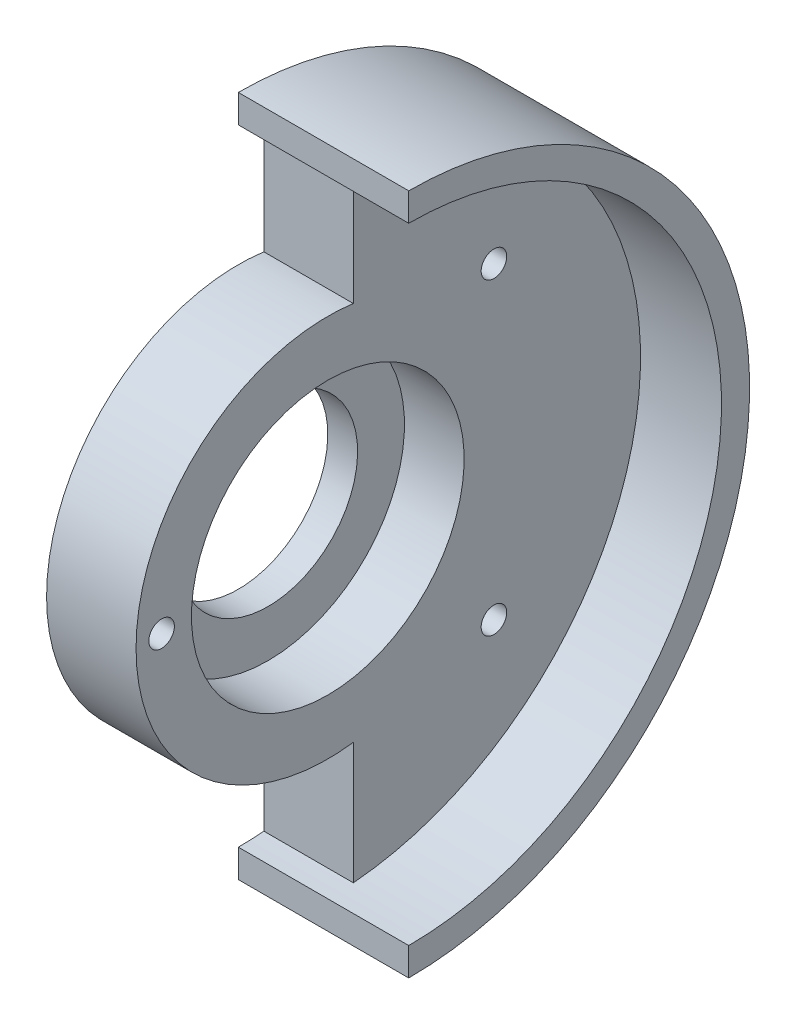
from build123d import *
from build123d.topology import SkipClean

# Parameters (mm, degrees)
CUT_EXTRUDE1_DEPTH      = 58.534772095
CUT_EXTRUDE1_DEPTH_BACK = 58.534772095
SKETCH2_R               = 1.5
SKETCH3_R               = 2.75
CUT_EXTRUDE2_DEPTH      = 5


with BuildPart() as part:
    # Sketch1 → Revolve1 (revolve)
    with BuildSketch(Plane.XY):
        Polygon((20, 40), (20, 36.7), (10.5, 36.7), (10.5, 16), (3.5, 16), (3.5, 10.5), (0, 10.5), (0, 40), align=None)
    revolve(axis=Axis((20, 0, 0), (-1, 0, 0)))

    # Sketch2 → Cut-Extrude1 (cut, two sides: drawn at the far end of the back side and taken through both)
    with SkipClean():  # the faces are left unmerged after this step: merging them gives an invalid solid
        with BuildSketch(Plane(origin=(10.5, 0, 0), x_dir=(0, 0, -1), z_dir=(1, 0, 0)).offset(-CUT_EXTRUDE1_DEPTH_BACK)):
            with Locations((-19.5, 0)):
                Circle(SKETCH2_R)
            with Locations((19.5, -18.091710809)):
                Circle(SKETCH2_R)
            with Locations((19.5, 18.091710809)):
                Circle(SKETCH2_R)
            with BuildLine():
                Line((3, 22.299103121), (3, 36.577178677))
                ThreePointArc((3, 36.577178677), (1.501256563, 36.669281814), (0, 36.7))
                Line((0, 36.7), (0, 40))
                ThreePointArc((0, 40), (-40, 0), (0, -40))
                Line((0, -40), (0, -36.7))
                ThreePointArc((0, -36.7), (1.501256563, -36.669281814), (3, -36.577178677))
                Line((3, -36.577178677), (3, -22.299103121))
                ThreePointArc((3, -22.299103121), (-22.5, 0), (3, 22.299103121))
            make_face()
        extrude(amount=CUT_EXTRUDE1_DEPTH + CUT_EXTRUDE1_DEPTH_BACK, mode=Mode.SUBTRACT)

    # Sketch3 → Cut-Extrude2 (cut)
    with SkipClean():  # the faces are left unmerged after this step: merging them gives an invalid solid
        with BuildSketch(Plane.ZY):
            with Locations((-19.5, 18.091710809)):
                Circle(SKETCH3_R)
            with Locations((19.5, 0)):
                Circle(SKETCH3_R)
            with Locations((-19.5, -18.091710809)):
                Circle(SKETCH3_R)
        extrude(amount=-CUT_EXTRUDE2_DEPTH, mode=Mode.SUBTRACT)


solid = part.part
